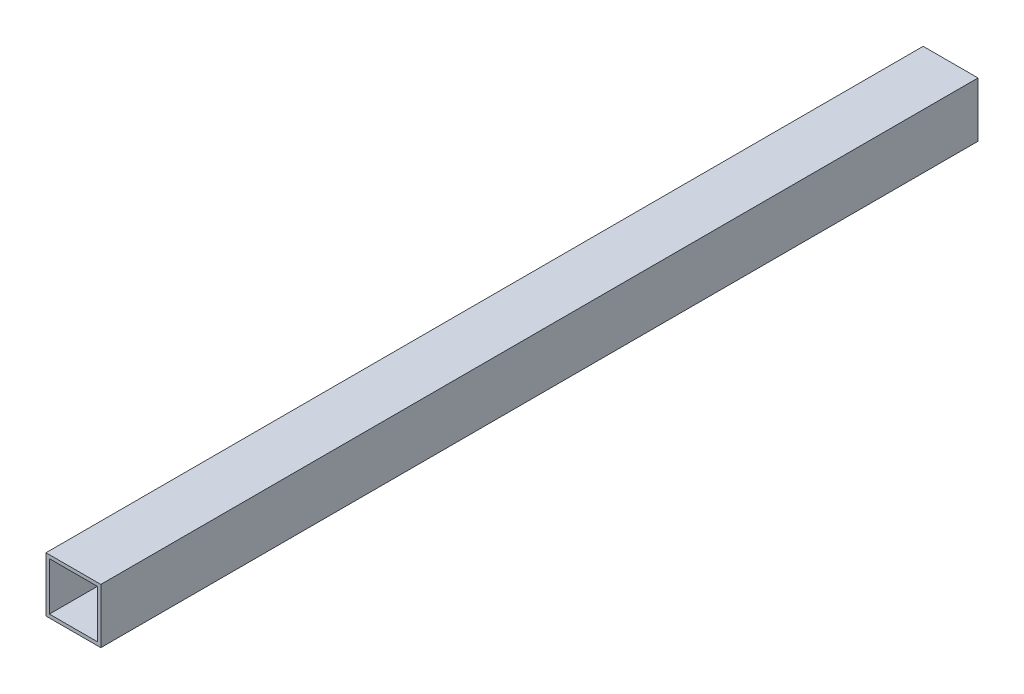
from build123d import *

# Parameters (mm, degrees)
SKETCH1_W           = 25.4
SKETCH1_H           = 25.4
BOSS_EXTRUDE1_DEPTH = 203.2
SHELL1_T            = -1.5875


with BuildPart() as part:
    # Sketch1 → Boss-Extrude1 (new, symmetric)
    with BuildSketch(Plane.XY):
        Rectangle(SKETCH1_W, SKETCH1_H)
    extrude(amount=BOSS_EXTRUDE1_DEPTH, both=True)

    # Shell1
    shell1_openings = [part.faces().sort_by_distance(p)[0] for p in [
        (0, 0, -203.2),
        (0, 0, 203.2),
    ]]
    offset(amount=SHELL1_T, openings=shell1_openings, kind=Kind.INTERSECTION)


solid = part.part
